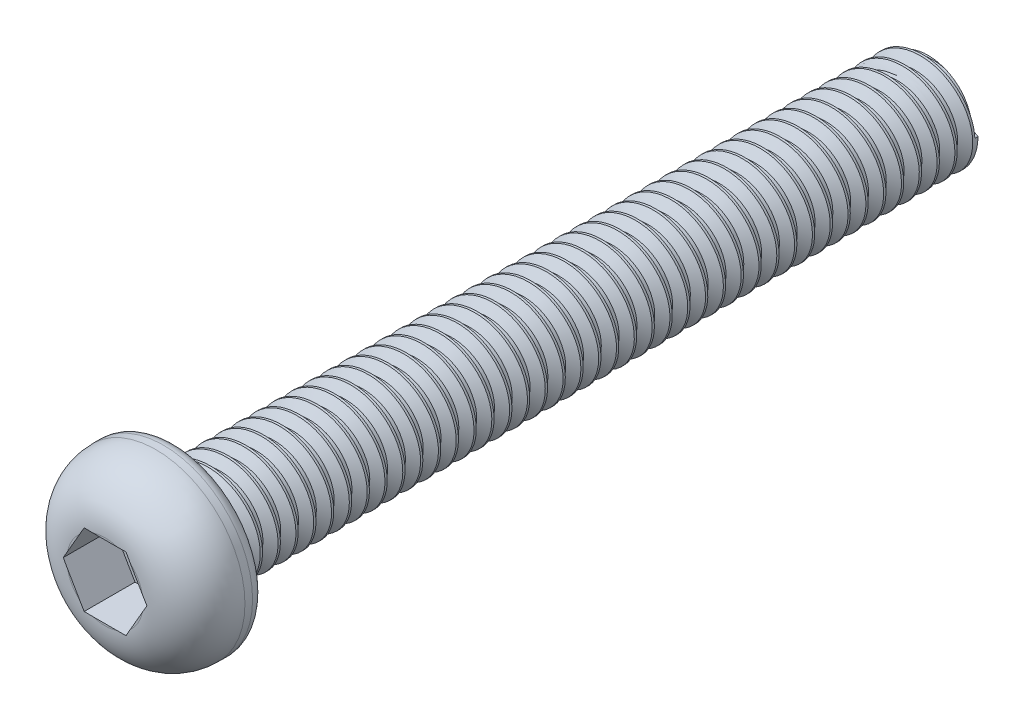
from build123d import *

# Parameters (mm, degrees)
SKETCH1_R           = 2
BOSS_EXTRUDE1_DEPTH = 30
SKETCH2_R           = 3.5
BOSS_EXTRUDE2_DEPTH = 2.8
FILLET1_R           = 2
FILLET2_R           = 0.5
CUT_EXTRUDE1_DEPTH  = 2
THREAD1_PITCH       = 0.7


with BuildPart() as part:
    # Sketch1 → Boss-Extrude1 (new body)
    with BuildSketch(Plane.XY):
        Circle(SKETCH1_R)
    extrude(amount=BOSS_EXTRUDE1_DEPTH)

    # Sketch2 → Boss-Extrude2 (add)
    with BuildSketch(Plane.XY.offset(30)):
        Circle(SKETCH2_R)
    extrude(amount=BOSS_EXTRUDE2_DEPTH)

    # Fillet1
    fillet1_edges = [part.edges().sort_by_distance(p)[0] for p in [
        (-3.5, 0, 32.8),
    ]]
    fillet(fillet1_edges, radius=FILLET1_R)

    # Fillet2
    fillet2_edges = [part.edges().sort_by_distance(p)[0] for p in [
        (-3.5, 0, 30),
    ]]
    fillet(fillet2_edges, radius=FILLET2_R)

    # Sketch3 → Cut-Extrude1 (cut)
    with BuildSketch(Plane.XY.offset(32.8)):
        Polygon((1.643730612, 0), (0.821865306, 1.423512467), (-0.821865306, 1.423512467), (-1.643730612, 0), (-0.821865306, -1.423512467), (0.821865306, -1.423512467), align=None)
    extrude(amount=-CUT_EXTRUDE1_DEPTH, mode=Mode.SUBTRACT)

    # Thread1: arcs per turn and ends read off the stored shape
    # Thread1: the profile of Thread Profile1 profile screwed along a right-hand helix through 42.285714 turns, 6 arcs to a turn; built about Z, then put on its axis
    thread1_z = Axis((0, 0, 0), (0, 0, 1))
    thread1_corners = [(2.0003, 0, -0.000173205), (2.0003, 0, 0.612673203), (1.621113887, 0, 0.393749999), (1.621113887, 0, 0.218749999)]
    with BuildLine(mode=Mode.PRIVATE) as thread1_profile:
        Line(thread1_corners[0], thread1_corners[1])
        Line(thread1_corners[1], thread1_corners[2])
        Line(thread1_corners[2], thread1_corners[3])
        Line(thread1_corners[3], thread1_corners[0])
    thread1_cap = Face(thread1_profile.wire())
    thread1_turn_angles = [0, 30, 60, 90, 120, 150, 180, 210, 240, 270, 300, 330, 360]
    thread1_turn_weights = [1, 0.8660254037844387, 1, 0.8660254037844387, 1, 0.8660254037844387, 1, 0.8660254037844387, 1, 0.8660254037844387, 1, 0.8660254037844387, 1]
    thread1_turn_rails = [Edge.make_bspline([Vector(p[0], p[1], 0).rotate(thread1_z, thread1_turn_angles[k]) / thread1_turn_weights[k] + Vector(0, 0, p[2] + THREAD1_PITCH * thread1_turn_angles[k] / 360) for k in range(13)], [0, 0, 0, 1, 1, 2, 2, 3, 3, 4, 4, 5, 5, 6, 6, 6], 2, thread1_turn_weights) for p in thread1_corners]
    thread1_turn_sides = [Face.make_surface_from_curves(thread1_turn_rails[p[0]], thread1_turn_rails[p[1]]) for p in [(0, 1), (1, 2), (2, 3), (3, 0)]]
    thread1_last_angles = [15120, 15150, 15180, 15201.428571429, 15222.857142857]
    thread1_last_weights = [1, 0.8660254037844387, 1, 0.9308737486442035, 1]
    thread1_last_rails = [Edge.make_bspline([Vector(p[0], p[1], 0).rotate(thread1_z, thread1_last_angles[k]) / thread1_last_weights[k] + Vector(0, 0, p[2] + THREAD1_PITCH * thread1_last_angles[k] / 360) for k in range(5)], [0, 0, 0, 1, 1, 2, 2, 2], 2, thread1_last_weights) for p in thread1_corners]
    thread1_last_sides = [Face.make_surface_from_curves(thread1_last_rails[p[0]], thread1_last_rails[p[1]]) for p in [(0, 1), (1, 2), (2, 3), (3, 0)]]
    thread1 = Plane(origin=(0, 0, 0), x_dir=(1, 0, 0), z_dir=(0, 0, 1)) * Solid(Shell([*[p.moved(Location((0, 0, THREAD1_PITCH * i))) for i in range(42) for p in thread1_turn_sides], *thread1_last_sides, thread1_cap, thread1_cap.rotate(thread1_z, 15222.857142857).moved(Location((0, 0, THREAD1_PITCH * 15222.857142857 / 360)))]))
    add(thread1, mode=Mode.SUBTRACT)

    # Sketch4 → Cut-Revolve2 (revolve, cut)
    with BuildSketch(Plane(origin=(0, 0, 0), x_dir=(1, 0, 0), z_dir=(0, 1, 0)), mode=Mode.PRIVATE) as cut_revolve2_sk:
        Polygon((-0.629619041, 0), (-2.427748352, -0.643653792), (-2.427748352, 0.543528108), (-0.629619041, 0.543528108), align=None)
    revolve(cut_revolve2_sk.sketch.rotate(Axis((0, 0, 30.005602512), (0, 0, -1)), 180), axis=Axis((0, 0, 30.005602512), (0, 0, -1)), mode=Mode.SUBTRACT)


solid = part.part
